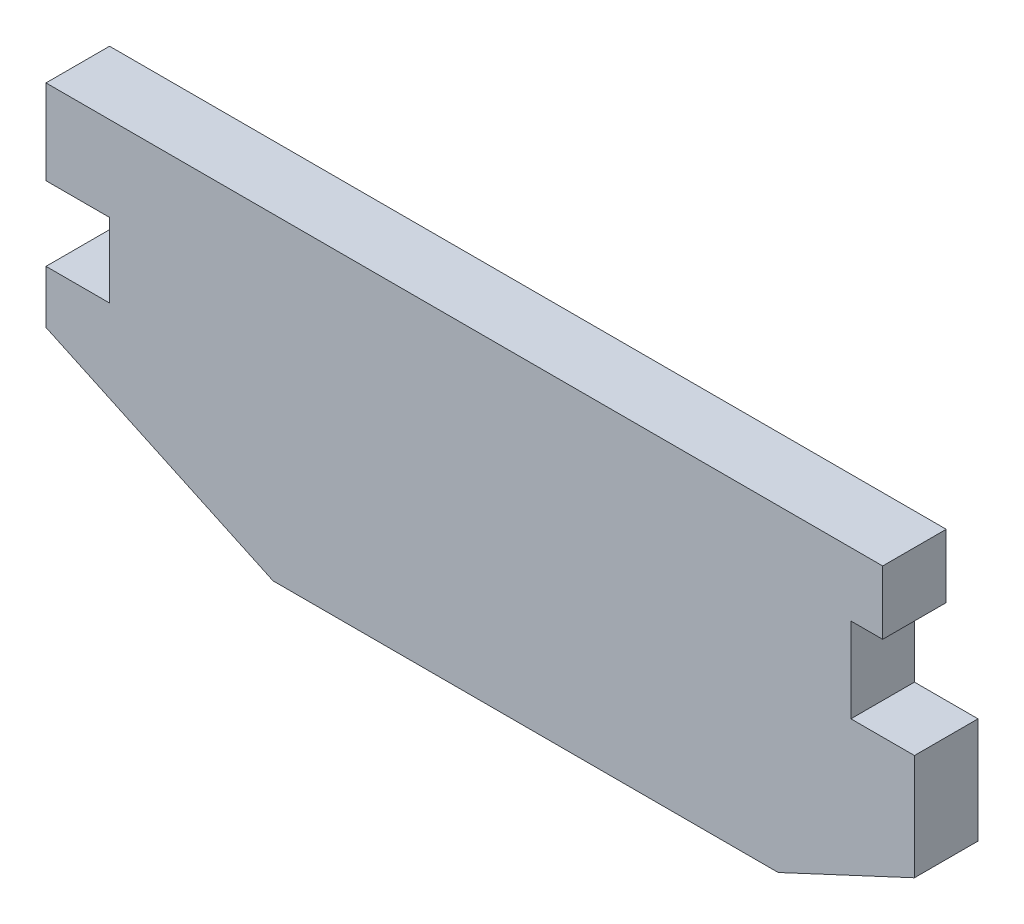
from build123d import *

# Parameters (mm, degrees)
ESQUISSE1_W             = 82
ESQUISSE1_H             = 30
BOSS_EXTRU_1_DEPTH      = 6
ENL_V_MAT_EXTRU_1_DEPTH = 10
ESQUISSE3_W             = 6
ESQUISSE3_H             = 7
ENL_V_MAT_EXTRU_2_DEPTH = 88.521425948
CHANFREIN1_SIZE         = 10
CHANFREIN1_SIZE2        = 21.445069205
CHANFREIN2_SIZE         = 6
CHANFREIN2_SIZE2        = 12.867041523


with BuildPart() as part:
    # Esquisse1 → Boss.-Extru.1 (new body)
    with BuildSketch(Plane.XY):
        with Locations((41, 15)):
            Rectangle(ESQUISSE1_W, ESQUISSE1_H)
    extrude(amount=BOSS_EXTRU_1_DEPTH)

    # Esquisse2 → Enlèv. mat.-Extru.1 (cut)
    with BuildSketch(Plane.XY.offset(6)):
        Polygon((82, 30), (79, 30), (79, 24), (76, 24), (76, 16), (82, 16), align=None)
    extrude(amount=-ENL_V_MAT_EXTRU_1_DEPTH, mode=Mode.SUBTRACT)

    # Esquisse3 → Enlèv. mat.-Extru.2 (cut, through all)
    with BuildSketch(Plane.XY.offset(6)):
        with Locations((3, 18.5)):
            Rectangle(ESQUISSE3_W, ESQUISSE3_H)
    extrude(amount=-ENL_V_MAT_EXTRU_2_DEPTH, mode=Mode.SUBTRACT)

    # Chanfrein1
    chanfrein1_edges = [part.edges().sort_by_distance(p)[0] for p in [
        (0, 0, 3),
    ]]
    chanfrein1_side = [part.faces().sort_by_distance(p)[0] for p in [
        (0, 7.5, 3),
    ]]
    chamfer(chanfrein1_edges, length=CHANFREIN1_SIZE, length2=CHANFREIN1_SIZE2, reference=chanfrein1_side[0])

    # Chanfrein2
    chanfrein2_edges = [part.edges().sort_by_distance(p)[0] for p in [
        (82, 0, 3),
    ]]
    chanfrein2_side = [part.faces().sort_by_distance(p)[0] for p in [
        (82, 8, 3),
    ]]
    chamfer(chanfrein2_edges, length=CHANFREIN2_SIZE, length2=CHANFREIN2_SIZE2, reference=chanfrein2_side[0])


solid = part.part
